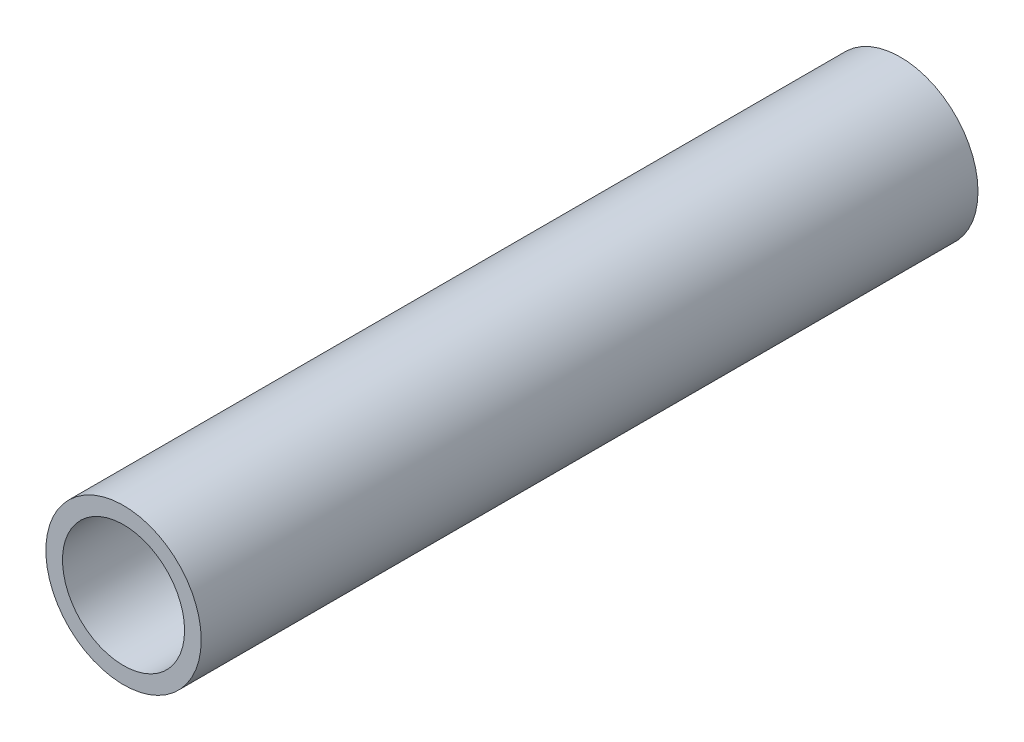
from build123d import *

# Parameters (mm, degrees)
SKETCH1_R           = 3.5
SKETCH1_R_2         = 2.75
BOSS_EXTRUDE1_DEPTH = 35


with BuildPart() as part:
    # Sketch1 → Boss-Extrude1 (new body)
    with BuildSketch(Plane.XY):
        Circle(SKETCH1_R)
        Circle(SKETCH1_R_2, mode=Mode.SUBTRACT)
    extrude(amount=BOSS_EXTRUDE1_DEPTH)


solid = part.part
